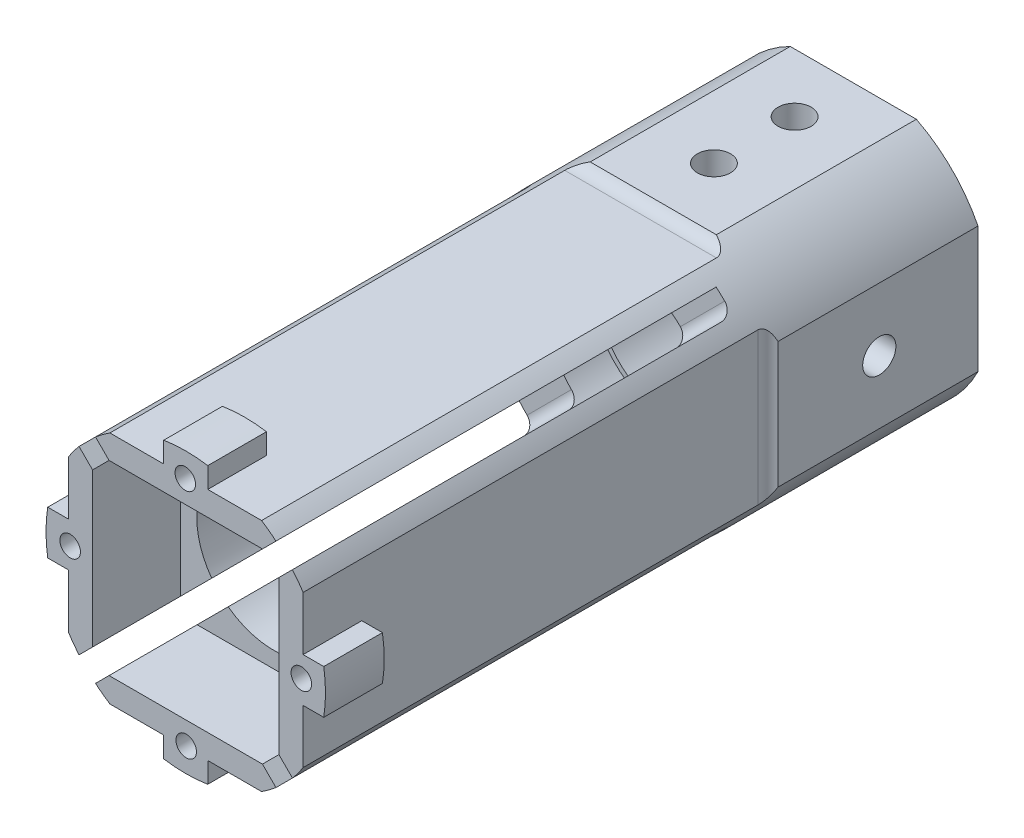
from build123d import *

# Parameters (mm, degrees)
SKETCH1_R           = 9.525
SKETCH1_R_2         = 4.25
BOSS_EXTRUDE1_DEPTH = 45.5
SKETCH2_R           = 4.9022
CUT_EXTRUDE1_DEPTH  = 12.5
SKETCH3_R           = 14.693864286
SKETCH3_W           = 16
SKETCH3_H           = 16
CUT_EXTRUDE2_DEPTH  = 40
SKETCH14_W          = 12.7
SKETCH14_H          = 12.7
CUT_EXTRUDE10_DEPTH = 6
CUT_EXTRUDE8_DEPTH  = 30
FILLET6_R           = 0.79375
FILLET4_R           = 1
SKETCH15_R          = 1.1303
CUT_EXTRUDE11_DEPTH = 50
SKETCH17_R          = 1.1303
CUT_EXTRUDE13_DEPTH = 60
SKETCH18_W          = 30.385302108
SKETCH18_H          = 28.40257804
SKETCH18_W_2        = 17
SKETCH18_H_2        = 17
CUT_EXTRUDE14_DEPTH = 60
CIRPATTERN2_START   = 0.79375
CIRPATTERN2_DEPTH   = 8.73125
CIRPATTERN2_START_2 = -9.52500012
CIRPATTERN2_2_DEPTH = 19.05000012
SKETCH19_R          = 5.25
CUT_EXTRUDE15_DEPTH = 50
BOSS_EXTRUDE2_START = -4
BOSS_EXTRUDE2_DEPTH = 4
SKETCH21_R          = 0.7
CUT_EXTRUDE17_DEPTH = 3.175
CIRPATTERN3_COUNT   = 4


with BuildPart() as part:
    # Sketch1 → Boss-Extrude1 (new body)
    with BuildSketch(Plane.XY):
        Circle(SKETCH1_R)
        Circle(SKETCH1_R_2, mode=Mode.SUBTRACT)
    extrude(amount=BOSS_EXTRUDE1_DEPTH)

    # Sketch2 → Cut-Extrude1 (cut)
    with BuildSketch(Plane(origin=(0, 0, 0), x_dir=(-1, 0, 0), z_dir=(0, 0, -1))):
        Circle(SKETCH2_R)
    extrude(amount=-CUT_EXTRUDE1_DEPTH, mode=Mode.SUBTRACT)

    # Sketch3 → Cut-Extrude2 (cut)
    with BuildSketch(Plane(origin=(0, 0, 13.5), x_dir=(-1, 0, 0), z_dir=(0, 0, -1))):
        Circle(SKETCH3_R)
        Rectangle(SKETCH3_W, SKETCH3_H, mode=Mode.SUBTRACT)
    extrude(amount=-CUT_EXTRUDE2_DEPTH, mode=Mode.SUBTRACT)

    # Sketch14 → Cut-Extrude10 (cut)
    with BuildSketch(Plane.XY.offset(45.5)):
        Rectangle(SKETCH14_W, SKETCH14_H)
    extrude(amount=-CUT_EXTRUDE10_DEPTH, mode=Mode.SUBTRACT)

    # Sketch11 → Cut-Extrude8 (cut)
    with BuildSketch(Plane.XY.offset(45.5)):
        with BuildLine():
            Line((-0.561266008, -0.561266008), (-7.411347572, 6.288815557))
            ThreePointArc((-7.411347572, 6.288815557), (-7.411347572, 7.411347572), (-6.288815557, 7.411347572))
            Line((-6.288815557, 7.411347572), (0.561266008, 0.561266008))
            ThreePointArc((0.561266008, 0.561266008), (0.561266008, -0.561266008), (-0.561266008, -0.561266008))
        make_face()
    extrude(amount=-CUT_EXTRUDE8_DEPTH, mode=Mode.SUBTRACT)

    # Fillet6
    fillet6_edges = [part.edges().sort_by_distance(p)[0] for p in [
        (-4.270779765, 5.39331178, 15.5),
        (-5.39331178, 4.270779765, 15.5),
    ]]
    fillet(fillet6_edges, radius=FILLET6_R - 0.0001)  # a hair under: the kernel refuses the full size

    # Fillet4
    fillet4_edges = [part.edges().sort_by_distance(p)[0] for p in [
        (-8, 0, 13.5),
        (0, -8, 13.5),
        (8, 0, 13.5),
        (0, 8, 13.5),
    ]]
    fillet(fillet4_edges, radius=FILLET4_R)

    # Sketch15 → Cut-Extrude11 (cut)
    with BuildSketch(Plane(origin=(9.525, 0, 0), x_dir=(0, 0, -1), z_dir=(1, 0, 0))):
        with Locations((-6.727901899, 0)):
            Circle(SKETCH15_R)
    extrude(amount=-CUT_EXTRUDE11_DEPTH, mode=Mode.SUBTRACT)

    # Sketch17 → Cut-Extrude13 (cut)
    with BuildSketch(Plane(origin=(0, -9.525, 0), x_dir=(-1, 0, 0), z_dir=(0, -1, 0))):
        with Locations(Location((0, -4, 0), (0, 0, 90))):
            Circle(SKETCH17_R)
        with Locations(Location((0, -9.5, 0), (0, 0, 90))):
            Circle(SKETCH17_R)
    extrude(amount=-CUT_EXTRUDE13_DEPTH, mode=Mode.SUBTRACT)

    # Sketch18 → Cut-Extrude14 (cut)
    with BuildSketch(Plane(origin=(0, 0, 0), x_dir=(-1, 0, 0), z_dir=(0, 0, -1))):
        Rectangle(SKETCH18_W, SKETCH18_H)
        Rectangle(SKETCH18_W_2, SKETCH18_H_2, mode=Mode.SUBTRACT)
    extrude(amount=-CUT_EXTRUDE14_DEPTH, mode=Mode.SUBTRACT)

    # CirPattern2: read off the stored shape, not the designer's step
    # CirPattern2 outline → CirPattern2 (cut)
    with BuildSketch(Plane(origin=(0, 0, 0), x_dir=(0.7071067811865471, 0.707106781186548, 0), z_dir=(0.707106781186548, -0.707106781186547, 0)).offset(CIRPATTERN2_START)):
        with BuildLine():
            Line((0.79375, 45.5), (-0.79375, 45.5))
            Line((-0.79375, 45.5), (-0.79375, 16.29375))
            ThreePointArc((-0.79375, 16.29375), (-0.561266008, 15.732483992), (0, 15.5))
            ThreePointArc((0, 15.5), (0.561266008, 15.732483992), (0.79375, 16.29375))
            Line((0.79375, 16.29375), (0.79375, 45.5))
        make_face()
    extrude(amount=CIRPATTERN2_DEPTH, mode=Mode.SUBTRACT)

    # CirPattern2 2 outline → CirPattern2 2 (cut)
    with BuildSketch(Plane(origin=(0, 0, 0), x_dir=(0.7071067811865551, -0.70710678118654, 0), z_dir=(0.70710678118654, 0.707106781186555, 0)).offset(CIRPATTERN2_START_2)):
        with BuildLine():
            Line((0, -15.5), (-0.79375, -15.5))
            Line((-0.79375, -15.5), (-0.79375, -45.5))
            Line((-0.79375, -45.5), (0.79375, -45.5))
            Line((0.79375, -45.5), (0.79375, -16.29375))
            ThreePointArc((0.79375, -16.29375), (0.561266008, -15.732483992), (0, -15.5))
        make_face()
    extrude(amount=CIRPATTERN2_2_DEPTH, mode=Mode.SUBTRACT)

    # Sketch19 → Cut-Extrude15 (cut)
    with BuildSketch(Plane(origin=(0, 0, 12.5), x_dir=(-1, 0, 0), z_dir=(0, 0, -1))):
        Circle(SKETCH19_R)
    extrude(amount=-CUT_EXTRUDE15_DEPTH, mode=Mode.SUBTRACT)

    # Sketch20 → Boss-Extrude2 (add)
    with BuildSketch(Plane.XY.offset(45.5).offset(BOSS_EXTRUDE2_START)):
        with BuildLine():
            Line((9.406148255, 1.5), (8, 1.5))
            Line((8, 1.5), (8, -1.5))
            Line((8, -1.5), (9.406148255, -1.5))
            ThreePointArc((9.406148255, -1.5), (9.495240574, -0.752350606), (9.525, 0))
            ThreePointArc((9.525, 0), (9.495240574, 0.752350606), (9.406148255, 1.5))
        make_face()
        with BuildLine():
            Line((-8, -1.5), (-8, 1.5))
            Line((-8, 1.5), (-9.406148255, 1.5))
            ThreePointArc((-9.406148255, 1.5), (-9.525, 0), (-9.406148255, -1.5))
            Line((-9.406148255, -1.5), (-8, -1.5))
        make_face()
        with BuildLine():
            Line((1.5, -9.406148255), (1.5, -8))
            Line((1.5, -8), (-1.5, -8))
            Line((-1.5, -8), (-1.5, -9.406148255))
            ThreePointArc((-1.5, -9.406148255), (0, -9.525), (1.5, -9.406148255))
        make_face()
        with BuildLine():
            Line((-1.5, 8), (1.5, 8))
            Line((1.5, 8), (1.5, 9.406148255))
            ThreePointArc((1.5, 9.406148255), (0, 9.525), (-1.5, 9.406148255))
            Line((-1.5, 9.406148255), (-1.5, 8))
        make_face()
    extrude(amount=BOSS_EXTRUDE2_DEPTH)

    # Sketch21 → Cut-Extrude17 (cut)
    with BuildSketch(Plane.XY.offset(45.5)):
        with Locations((-0.031208627, 7.878074128)):
            Circle(SKETCH21_R)
    cut_extrude17 = extrude(amount=-CUT_EXTRUDE17_DEPTH, mode=Mode.SUBTRACT)

    # CirPattern3: Cut-Extrude17 ×4 about axis
    cirpattern3_axis = Axis((0, 0, 0), (0, 0, 1))
    for i in range(1, CIRPATTERN3_COUNT):
        add(cut_extrude17.rotate(cirpattern3_axis, i * 360 / CIRPATTERN3_COUNT), mode=Mode.SUBTRACT)


solid = part.part
